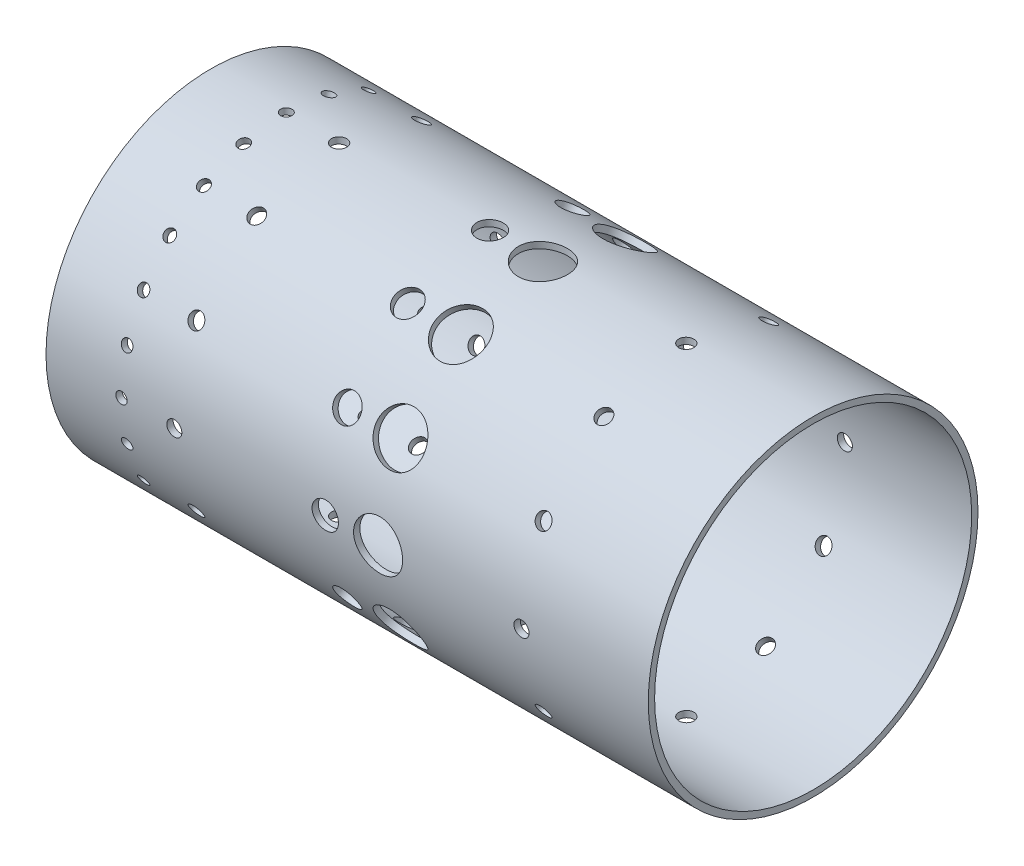
from build123d import *

# Parameters (mm, degrees)
SKETCH1_R           = 21.844
SKETCH1_R_2         = 21.0058
BOSS_EXTRUDE1_DEPTH = 79.8044
SKETCH4_R           = 0.75
CUT_EXTRUDE1_DEPTH  = 86.574896619
CIRPATTERN1_COUNT   = 24
SKETCH5_R           = 1
CUT_EXTRUDE3_DEPTH  = 86.574896763
CIRPATTERN2_COUNT   = 12
SKETCH6_R           = 1.75
CUT_EXTRUDE4_DEPTH  = 86.574896763
CIRPATTERN3_COUNT   = 12
SKETCH7_R           = 3.25
CUT_EXTRUDE5_DEPTH  = 86.574896774
CIRPATTERN5_COUNT   = 12
SKETCH8_R           = 1
CUT_EXTRUDE6_DEPTH  = 86.574896774
CIRPATTERN6_COUNT   = 12


with BuildPart() as part:
    # Sketch1 → Boss-Extrude1 (new body)
    with BuildSketch(Plane(origin=(0, 0, 0), x_dir=(0, 0, -1), z_dir=(1, 0, 0))):
        Circle(SKETCH1_R)
        Circle(SKETCH1_R_2, mode=Mode.SUBTRACT)
    extrude(amount=BOSS_EXTRUDE1_DEPTH)

    # Sketch4 → Cut-Extrude1 (cut, through all)
    with BuildSketch(Plane(origin=(0, 0, 0), x_dir=(1, 0, 0), z_dir=(0, 1, 0))):
        with Locations((10, 0)):
            Circle(SKETCH4_R)
    cut_extrude1 = extrude(amount=-CUT_EXTRUDE1_DEPTH, mode=Mode.SUBTRACT)

    # CirPattern1: Cut-Extrude1 ×24 about axis
    cirpattern1_axis = Axis((0, 0, 0), (1, 0, 0))
    for i in range(1, CIRPATTERN1_COUNT):
        add(cut_extrude1.rotate(cirpattern1_axis, i * 360 / CIRPATTERN1_COUNT), mode=Mode.SUBTRACT)

    # Sketch5 → Cut-Extrude3 (cut, through all)
    with BuildSketch(Plane(origin=(0, 0, 0), x_dir=(1, 0, 0), z_dir=(0, 1, 0))):
        with Locations((17, 0)):
            Circle(SKETCH5_R)
    cut_extrude3 = extrude(amount=-CUT_EXTRUDE3_DEPTH, mode=Mode.SUBTRACT)

    # CirPattern2: Cut-Extrude3 ×12 about axis
    cirpattern2_axis = Axis((0, 0, 0), (1, 0, 0))
    for i in range(1, CIRPATTERN2_COUNT):
        add(cut_extrude3.rotate(cirpattern2_axis, i * 360 / CIRPATTERN2_COUNT), mode=Mode.SUBTRACT)

    # Sketch6 → Cut-Extrude4 (cut, through all)
    with BuildSketch(Plane(origin=(0, 0, 0), x_dir=(1, 0, 0), z_dir=(0, 1, 0))):
        with Locations((37, 0)):
            Circle(SKETCH6_R)
    cut_extrude4 = extrude(amount=-CUT_EXTRUDE4_DEPTH, mode=Mode.SUBTRACT)

    # CirPattern3: Cut-Extrude4 ×12 about axis
    cirpattern3_axis = Axis((0, 0, 0), (1, 0, 0))
    for i in range(1, CIRPATTERN3_COUNT):
        add(cut_extrude4.rotate(cirpattern3_axis, i * 360 / CIRPATTERN3_COUNT), mode=Mode.SUBTRACT)

    # Sketch7 → Cut-Extrude5 (cut, through all)
    with BuildSketch(Plane(origin=(0, 0, 0), x_dir=(1, 0, 0), z_dir=(0, 1, 0))):
        with Locations((44, 0)):
            Circle(SKETCH7_R)
    cut_extrude5 = extrude(amount=-CUT_EXTRUDE5_DEPTH, mode=Mode.SUBTRACT)

    # CirPattern5: Cut-Extrude5 ×12 about axis
    cirpattern5_axis = Axis((0, 0, 0), (1, 0, 0))
    for i in range(1, CIRPATTERN5_COUNT):
        add(cut_extrude5.rotate(cirpattern5_axis, i * 360 / CIRPATTERN5_COUNT), mode=Mode.SUBTRACT)

    # Sketch8 → Cut-Extrude6 (cut, through all)
    with BuildSketch(Plane.XY):
        with Locations((63, 0)):
            Circle(SKETCH8_R)
    cut_extrude6 = extrude(amount=-CUT_EXTRUDE6_DEPTH, mode=Mode.SUBTRACT)

    # CirPattern6: Cut-Extrude6 ×12 about axis
    cirpattern6_axis = Axis((0, 0, 0), (1, 0, 0))
    for i in range(1, CIRPATTERN6_COUNT):
        add(cut_extrude6.rotate(cirpattern6_axis, i * 360 / CIRPATTERN6_COUNT), mode=Mode.SUBTRACT)


solid = part.part
